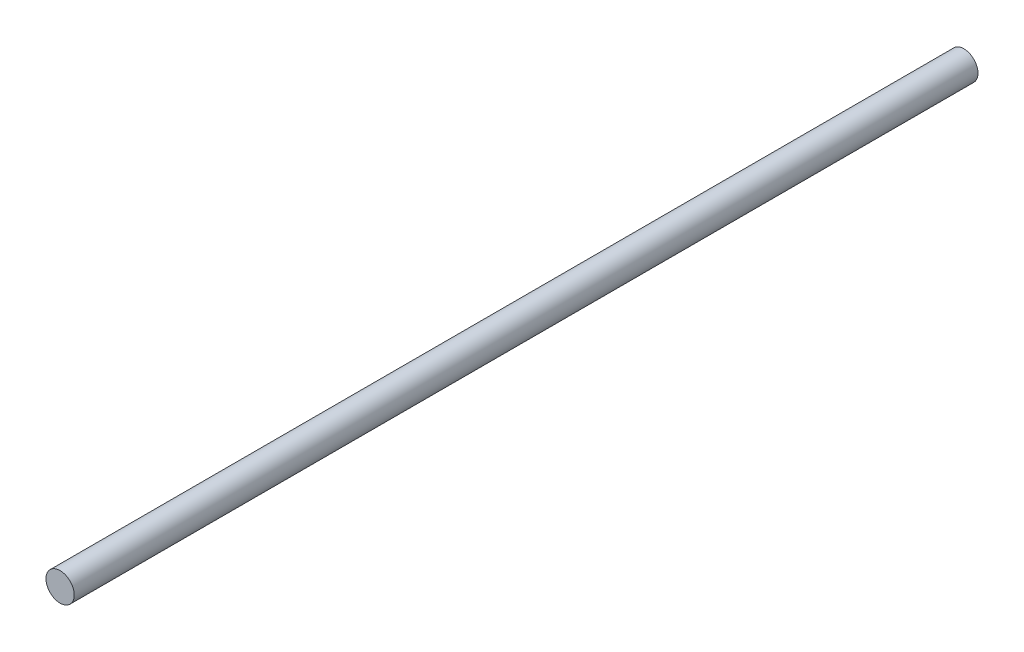
from build123d import *

# Parameters (mm, degrees)
SKETCH1_R           = 6.35
BOSS_EXTRUDE1_DEPTH = 203.2


with BuildPart() as part:
    # Sketch1 → Boss-Extrude1 (new, symmetric)
    with BuildSketch(Plane.XY):
        Circle(SKETCH1_R)
    extrude(amount=BOSS_EXTRUDE1_DEPTH, both=True)


solid = part.part
